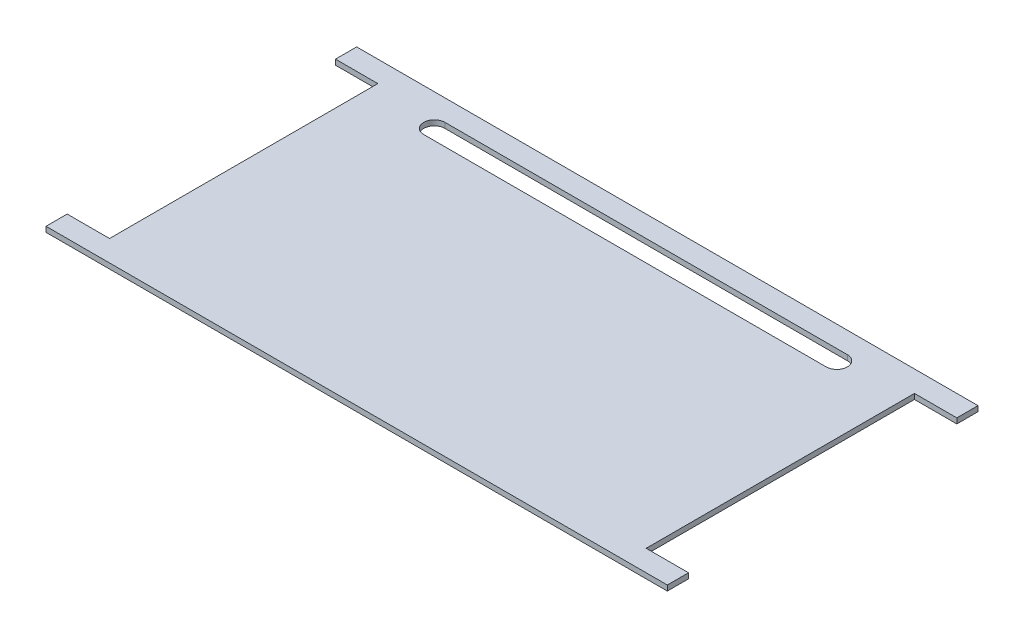
from build123d import *

# Parameters (mm, degrees)
SKETCH1_W           = 558.8
SKETCH1_H           = 279.4
BOSS_EXTRUDE1_DEPTH = 2.38125
SKETCH2_W           = 38.1
SKETCH2_H           = 241.3
CUT_EXTRUDE1_DEPTH  = 313.41499869
CUT_EXTRUDE3_DEPTH  = 313.41499869


with BuildPart() as part:
    # Sketch1 → Boss-Extrude1 (new, symmetric)
    with BuildSketch(Plane(origin=(0, 0, 0), x_dir=(1, 0, 0), z_dir=(0, 1, 0))):
        Rectangle(SKETCH1_W, SKETCH1_H)
    extrude(amount=BOSS_EXTRUDE1_DEPTH, both=True)

    # Sketch2 → Cut-Extrude1 (cut, through all)
    with BuildSketch(Plane(origin=(0, 2.38125, 0), x_dir=(1, 0, 0), z_dir=(0, 1, 0))):
        with Locations((-260.35, 0)):
            Rectangle(SKETCH2_W, SKETCH2_H)
        with Locations((260.35, 0)):
            Rectangle(SKETCH2_W, SKETCH2_H)
    extrude(amount=-CUT_EXTRUDE1_DEPTH, mode=Mode.SUBTRACT)

    # Sketch4 → Cut-Extrude3 (cut, through all)
    with BuildSketch(Plane(origin=(0, 2.38125, 0), x_dir=(1, 0, 0), z_dir=(0, 1, 0))):
        with BuildLine():
            Line((-180.975, 120.65), (180.975, 120.65))
            ThreePointArc((180.975, 120.65), (190.5, 111.125), (180.975, 101.6))
            Line((180.975, 101.6), (-180.975, 101.6))
            ThreePointArc((-180.975, 101.6), (-190.5, 111.125), (-180.975, 120.65))
        make_face()
    extrude(amount=-CUT_EXTRUDE3_DEPTH, mode=Mode.SUBTRACT)


solid = part.part
